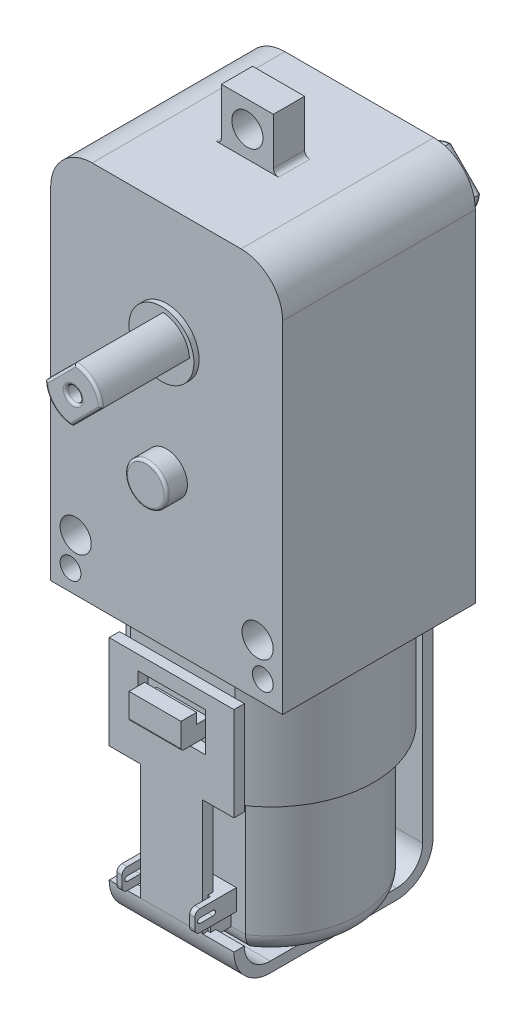
from build123d import *

# Parameters (mm, degrees)
SKETCH1_R                 = 1.5000000000000009
SKETCH1_R_2               = 1.5000000000000018
BOSS_EXTRUDE1_DEPTH       = 9.27
SKETCH2_R                 = 1.0000000000000033
CUT_EXTRUDE1_DEPTH        = 4.5
SKETCH3_R                 = 1.5000000000000009
BOSS_EXTRUDE2_DEPTH       = 1.5
FILLET1_R                 = 0.5
BOSS_EXTRUDE3_DEPTH       = 11.33
BOSS_EXTRUDE4_DEPTH       = 8
BOSS_EXTRUDE7_DEPTH       = 5.5
FILLET2_R                 = 1.75
BOSS_EXTRUDE8_DEPTH       = 2.5
BOSS_EXTRUDE10_DEPTH      = 2
SKETCH11_R                = 0.99
BOSS_EXTRUDE11_DEPTH      = 0.75
FILLET3_R                 = 0.2
FILLET4_R                 = 0.5
EXTRUDE_THIN2_DEPTH       = 6
SKETCH17_R                = 5.444401468277598
CUT_EXTRUDE4_DEPTH        = 1
CUT_EXTRUDE6_START        = -1
CUT_EXTRUDE6_DEPTH        = 1
BOSS_EXTRUDE13_DEPTH      = 1
BOSS_EXTRUDE13_DEPTH_BACK = 2.5
SKETCH14_W                = 6.5
SKETCH14_H                = 1.9999999999999991
BOSS_EXTRUDE14_DEPTH      = 0.5
BOSS_EXTRUDE17_DEPTH      = 2
BOSS_EXTRUDE18_REACH      = 53.271
SKETCH21_W                = 5
SKETCH21_H                = 1.500000000000007
SKETCH22_R                = 2.7
SKETCH22_R_2              = 0.7000000000000001
BOSS_EXTRUDE19_DEPTH      = 9
CUT_EXTRUDE7_DEPTH        = 9
SKETCH24_R                = 3.1250000000000004
SKETCH24_R_2              = 0.7000000000000001
BOSS_EXTRUDE20_DEPTH      = 0.5
CUT_EXTRUDE8_DEPTH        = 8.5
SKETCH26_R                = 2
BOSS_EXTRUDE21_DEPTH      = 2
FILLET5_R                 = 0.25


with BuildPart() as part:
    # Sketch1 → Boss-Extrude1 (new, symmetric)
    with BuildSketch(Plane.XY):
        with BuildLine():
            Line((-11.160000000000002, -18.400000000000002), (11.159999999999998, -18.400000000000002))
            Line((11.159999999999998, -18.400000000000002), (11.159999999999998, 14.399999999999997))
            ThreePointArc((11.159999999999998, 14.399999999999997), (9.98842712474619, 17.228427124746187), (7.159999999999998, 18.4))
            Line((7.159999999999998, 18.4), (-7.160000000000001, 18.4))
            ThreePointArc((-7.160000000000001, 18.4), (-9.988427124746192, 17.228427124746187), (-11.160000000000002, 14.399999999999997))
            Line((-11.160000000000002, 14.399999999999997), (-11.160000000000002, -18.400000000000002))
        make_face()
        with Locations((8.750000000000007, -13.399999999999995)):
            Circle(SKETCH1_R, mode=Mode.SUBTRACT)
        with Locations(Location((-8.749999999999998, -13.399999999999997, 0), (0, 0, 180))):
            Circle(SKETCH1_R_2, mode=Mode.SUBTRACT)
    extrude(amount=BOSS_EXTRUDE1_DEPTH, both=True)

    # Sketch2 → Cut-Extrude1 (cut)
    with BuildSketch(Plane.XY.offset(9.27)):
        with Locations((9.250000000000009, -16.400000000000006)):
            Circle(SKETCH2_R)
        with Locations(Location((-9.249999999999998, -16.40000000000001, 0), (0, 0, 180))):
            Circle(SKETCH2_R)
    cut_extrude1 = extrude(amount=-CUT_EXTRUDE1_DEPTH, mode=Mode.SUBTRACT)

    # Mirror1: Cut-Extrude1 across plane
    add(cut_extrude1.mirror(Plane.XY), mode=Mode.SUBTRACT)

    # Sketch3 → Boss-Extrude2 (add, symmetric)
    with BuildSketch(Plane.XY):
        Polygon((-2.5, 18.4), (2.5, 18.4), (2.5, 23.400000000000002), (-2.5, 23.400000000000006), align=None)
        with Locations((1.76e-15, 20.900000000000002)):
            Circle(SKETCH3_R, mode=Mode.SUBTRACT)
    extrude(amount=BOSS_EXTRUDE2_DEPTH, both=True)

    # Fillet1
    fillet1_edges = [part.edges().sort_by_distance(p)[0] for p in [
        (2.5, 18.4, 0),
        (-2.5, 18.4, 0),
    ]]
    fillet(fillet1_edges, radius=FILLET1_R)

    # Sketch4 → Boss-Extrude3 (add)
    with BuildSketch(Plane.XZ.offset(18.400000000000002)):
        with BuildLine():
            Line((-5.02893626923229, -9.27), (5.02893626923229, -9.27))
            ThreePointArc((5.02893626923229, -9.27), (9.866661310245673, -0.7811363887090915), (5.028936269232289, 7.707727222581812))
            Line((5.028936269232289, 7.707727222581812), (-5.028936269232289, 7.707727222581812))
            ThreePointArc((-5.028936269232289, 7.707727222581812), (-9.866661310245672, -0.7811363887090925), (-5.02893626923229, -9.27))
        make_face()
    extrude(amount=BOSS_EXTRUDE3_DEPTH)

    # Sketch5 → Boss-Extrude4 (add)
    with BuildSketch(Plane.XZ.offset(29.730000000000004)):
        with BuildLine():
            Line((4.629510389115316, 6.3077272225818115), (-4.629510389115315, 6.3077272225818115))
            ThreePointArc((-4.629510389115315, 6.3077272225818115), (-8.466661310245671, -0.7811363887090927), (-4.629510389115316, -7.869999999999998))
            Line((-4.629510389115316, -7.869999999999998), (4.629510389115316, -7.869999999999998))
            ThreePointArc((4.629510389115316, -7.869999999999998), (8.466661310245673, -0.7811363887090937), (4.629510389115316, 6.3077272225818115))
        make_face()
    extrude(amount=BOSS_EXTRUDE4_DEPTH)

    # Sketch9 → Boss-Extrude8 (add, symmetric)
    with BuildSketch(Plane(origin=(0, 0, 0), x_dir=(0, 0, -1), z_dir=(1, 0, 0))):
        with BuildLine():
            Line((10.449999999999996, -22.735000000000007), (11.949999999999996, -22.735000000000007))
            Line((11.949999999999996, -22.735000000000007), (11.949999999999996, -24.985000000000003))
            ThreePointArc((11.949999999999996, -24.985000000000003), (11.876776695296632, -25.16177669529664), (11.699999999999996, -25.235000000000003))
            Line((11.699999999999996, -25.235000000000003), (9.269999999999996, -25.235000000000003))
            Line((9.269999999999996, -25.235000000000003), (9.269999999999996, -23.735))
            Line((9.269999999999996, -23.735), (10.449999999999996, -23.735))
            Line((10.449999999999996, -23.735), (10.449999999999996, -22.735000000000007))
        make_face()
    boss_extrude8 = extrude(amount=BOSS_EXTRUDE8_DEPTH, both=True)

    # Mirror2: Boss-Extrude8 across plane
    add(boss_extrude8.mirror(Plane.XY.offset(-0.78113639)))



with BuildPart() as body_2:
    # Sketch8 → Boss-Extrude7 (new body)
    with BuildSketch(Plane.XZ.offset(37.73)):
        with BuildLine():
            Line((4.629510389115312, 6.307727222581813), (-4.629510389115312, 6.307727222581813))
            ThreePointArc((-4.629510389115312, 6.307727222581813), (-8.466661310245671, -0.781136388709089), (-4.6295103891153175, -7.8699999999999966))
            Line((-4.6295103891153175, -7.8699999999999966), (4.629510389115311, -7.870000000000002))
            ThreePointArc((4.629510389115311, -7.870000000000002), (8.466661310245675, -0.7811363887090937), (4.629510389115312, 6.307727222581813))
        make_face()
    extrude(amount=BOSS_EXTRUDE7_DEPTH)

    # Fillet2
    # the kernel refuses this fillet: 1.75 mm, written as the material it takes off along each edge
    with BuildSketch(Plane(origin=(4.88e-15, -43.23, -0.7811363887090941), x_dir=(-0.06142631905832715, 0, 0.9981116206752353), z_dir=(0.9981116206752353, 0, 0.06142631905832715))) as fillet2_piece_1:
        with BuildLine():
            CenterArc((8.466661310245678 - FILLET2_R, -FILLET2_R), FILLET2_R, 0, 89.99999999999997)
            Line((8.466661310245678 - FILLET2_R, 0), (8.466661310245678, 0))
            Line((8.466661310245678, 0), (8.466661310245676, -FILLET2_R))
        make_face()
    revolve(axis=Axis((4.88e-15, -43.23, -0.7811363887090941), (0, -1, 0)), revolution_arc=172.95662825627966, mode=Mode.SUBTRACT)
    with BuildSketch(Plane(origin=(-9.004510389115318, -43.23, -7.869999999999994), x_dir=(0, 1, 0), z_dir=(1, 0, -5.8e-16))) as fillet2_piece_2:
        with BuildLine():
            CenterArc((FILLET2_R, FILLET2_R), FILLET2_R, 180, 90)
            Line((0, FILLET2_R), (0, 0))
            Line((0, 0), (FILLET2_R, 0))
        make_face()
    extrude(amount=18.009020778230628, mode=Mode.SUBTRACT)
    with BuildSketch(Plane(origin=(6.66e-15, -43.23, -0.7811363887090939), x_dir=(0.06142631905832556, 0, -0.9981116206752353), z_dir=(-0.9981116206752353, 0, -0.06142631905832556))) as fillet2_piece_3:
        with BuildLine():
            CenterArc((8.466661310245671 - FILLET2_R, -FILLET2_R), FILLET2_R, 0, 89.99999999999989)
            Line((8.466661310245671 - FILLET2_R, 0), (8.466661310245671, 0))
            Line((8.466661310245671, 0), (8.46666131024567, -FILLET2_R))
        make_face()
    revolve(axis=Axis((6.66e-15, -43.23, -0.7811363887090939), (0, -1, 0)), revolution_arc=172.95662825627988, mode=Mode.SUBTRACT)
    with BuildSketch(Plane(origin=(9.004510389115312, -43.23, 6.307727222581813), x_dir=(0, 1, 0), z_dir=(-1, 0, 0))) as fillet2_piece_4:
        with BuildLine():
            CenterArc((FILLET2_R, FILLET2_R), FILLET2_R, 180, 90)
            Line((0, FILLET2_R), (0, 0))
            Line((0, 0), (FILLET2_R, 0))
        make_face()
    extrude(amount=18.009020778230624, mode=Mode.SUBTRACT)

    # Sketch10 → Boss-Extrude10 (add)
    with BuildSketch(Plane.XZ.offset(43.23)):
        with BuildLine():
            Line((-3.962436119358896, 2.2188636112909066), (3.962436119358899, 2.2188636112909066))
            ThreePointArc((3.962436119358899, 2.2188636112909066), (8.2e-16, -5.751136388709094), (-3.962436119358896, 2.2188636112909066))
        make_face()
    extrude(amount=BOSS_EXTRUDE10_DEPTH)

    # Sketch11 → Boss-Extrude11 (add)
    with BuildSketch(Plane.XZ.offset(45.23)):
        with Locations(Location((1.52e-15, -0.8404766655493063, 0), (0, 0, 270))):
            Circle(SKETCH11_R)
    extrude(amount=BOSS_EXTRUDE11_DEPTH)

    # Fillet3
    fillet3_edges = [body_2.edges().sort_by_distance(p)[0] for p in [
        (1.82e-15, -45.98, 0.14952333445069366),
    ]]
    fillet(fillet3_edges, radius=FILLET3_R)

    # Fillet4
    fillet4_edges = [body_2.edges().sort_by_distance(p)[0] for p in [
        (2.11e-15, -43.23, -5.751136388709094),
        (-3.9624361193588964, -44.23, 2.2188636112909066),
        (1.33e-15, -43.23, 2.2188636112909066),
        (3.962436119358899, -44.23, 2.2188636112909066),
        (2.11e-15, -45.23, -5.751136388709094),
        (1.33e-15, -45.23, 2.2188636112909066),
    ]]
    fillet(fillet4_edges, radius=FILLET4_R)


with BuildPart() as part_1:
    add(part.part)

    add(body_2.part)  # Extrude-Thin2 merges body 2
    # Sketch16 → Extrude-Thin2 (add, symmetric)
    with BuildSketch(Plane(origin=(0, 0, 0), x_dir=(0, 0, -1), z_dir=(1, 0, 0))):
        with BuildLine():
            Line((-8.797727221290906, -20.800459056820337), (-8.7977272212909, -40.99999999999999))
            ThreePointArc((-8.7977272212909, -40.99999999999997), (-7.772600955443863, -43.474873734152965), (-5.297727221290895, -44.49999999999999))
            Line((-5.297727221290903, -44.5), (6.859999999999996, -44.5))
            ThreePointArc((6.860000000000013, -44.5), (9.334873734152866, -43.47487373415288), (10.360000000000005, -41))
            Line((10.359999999999994, -40.99999999999999), (10.359999999999992, -20.999999999999993))
            Line((10.359999999999992, -20.999999999999993), (9.359999999999992, -20.999999999999993))
            Line((9.359999999999992, -20.999999999999993), (9.359999999999994, -40.99999999999999))
            ThreePointArc((9.359999999999983, -40.999999999999986), (8.627766952966311, -42.76776695296633), (6.859999999999979, -43.5))
            Line((6.859999999999996, -43.5), (-5.297727221290903, -43.5))
            ThreePointArc((-5.297727221290911, -43.50000000000001), (-7.065494174257305, -42.767766952966426), (-7.7977272212909, -41.000000000000014))
            Line((-7.7977272212909, -40.99999999999999), (-7.797727221290906, -20.800459056820337))
            Line((-7.797727221290906, -20.800459056820337), (-8.797727221290906, -20.800459056820337))
        make_face()
    extrude(amount=EXTRUDE_THIN2_DEPTH, both=True)

    # Sketch17 → Cut-Extrude4 (cut)
    with BuildSketch(Plane.XZ.offset(44.5)):
        with Locations(Location((1.73e-15, -0.7811363887090937, 0), (0, 0, 270))):
            Circle(SKETCH17_R)
    extrude(amount=-CUT_EXTRUDE4_DEPTH, mode=Mode.SUBTRACT)


with BuildPart() as cut_extrude4_piece_1:
    # of the separate pieces the step leaves, piece 1, a body of its own (cut_extrude4_pieces)
    add(part_1.part.solids().sort_by_distance((-6, -44.5, 5.297727221))[0])

    # Sketch18 → Cut-Extrude6 (cut)
    with BuildSketch(Plane.XY.offset(8.797727221290911).offset(CUT_EXTRUDE6_START)):
        Polygon((6, -40.99999999999999), (2.999999999999999, -40.99999999999999), (3, -29.823949682632044), (6, -29.823949682632044), align=None)
        Polygon((-3.25, -22.183170727295014), (3.25, -22.183170727295014), (3.250000000000001, -25.933170727295014), (-3.250000000000001, -25.933170727295014), align=None)
        Polygon((-6, -29.823949682632044), (-3, -29.823949682632044), (-2.999999999999999, -40.99999999999999), (-6, -40.99999999999999), align=None)
    extrude(amount=CUT_EXTRUDE6_DEPTH, mode=Mode.SUBTRACT)


with BuildPart() as cut_extrude4_piece_2:
    # of the separate pieces the step leaves, piece 2, a body of its own (cut_extrude4_pieces)
    add(part_1.part.solids().sort_by_distance((3.705522905, -45.23, 1.718863611))[0])


with BuildPart() as cut_extrude6_piece_1:
    # of the separate pieces the step leaves, piece 1, a body of its own (cut_extrude6_pieces)
    add(cut_extrude4_piece_1.part.solids().sort_by_distance((-6, -44.5, 5.297727221))[0])

    # Sketch14 → Boss-Extrude13 (add, two sides: drawn at the far end of the back side and taken through both)
    with BuildSketch(Plane(origin=(0, -39, 0), x_dir=(1, 0, 0), z_dir=(0, 1, 0)).offset(-BOSS_EXTRUDE13_DEPTH_BACK)):
        with Locations((4.4e-16, -7.307727222581812)):
            Rectangle(SKETCH14_W, SKETCH14_H)
    extrude(amount=BOSS_EXTRUDE13_DEPTH + BOSS_EXTRUDE13_DEPTH_BACK)

    # Sketch15 → Boss-Extrude14 (add)
    with BuildSketch(Plane.ZY.offset(3.2499999999999996)):
        with BuildLine():
            Line((6.307727222581813, -38), (9.807727222581809, -38))
            ThreePointArc((9.807727222581809, -38), (10.161280613175085, -38.14644660940672), (10.307727222581812, -38.5))
            Line((10.307727222581812, -38.5), (10.307727222581812, -39.5))
            ThreePointArc((10.307727222581812, -39.5), (10.161280613175085, -39.85355339059328), (9.807727222581809, -40))
            Line((9.807727222581809, -40), (6.307727222581813, -40))
            Line((6.307727222581813, -40), (6.307727222581813, -38))
        make_face()
        with BuildLine():
            Line((9.807727222581812, -39.233411749660384), (8.557727222581814, -39.233411749660384))
            ThreePointArc((8.557727222581814, -39.233411749660384), (8.32431547292143, -39), (8.557727222581814, -38.766588250339616))
            Line((8.557727222581814, -38.766588250339616), (9.807727222581812, -38.766588250339616))
            ThreePointArc((9.807727222581812, -38.766588250339616), (10.041138972242196, -39), (9.807727222581812, -39.233411749660384))
        make_face(mode=Mode.SUBTRACT)
    boss_extrude14 = extrude(amount=BOSS_EXTRUDE14_DEPTH)

    # Mirror3: Boss-Extrude14 across plane
    add(boss_extrude14.mirror(Plane(origin=(0, 0, 0), x_dir=(0, 0, 1), z_dir=(1, 0, 0))))

    # Sketch6 → Boss-Extrude17 (add)
    with BuildSketch(Plane.XZ.offset(37.73)):
        with BuildLine():
            Line((4.629510389115312, 6.307727222581813), (-4.629510389115312, 6.307727222581813))
            ThreePointArc((-4.629510389115312, 6.307727222581813), (-8.466661310245671, -0.781136388709089), (-4.6295103891153175, -7.8699999999999966))
            Line((-4.6295103891153175, -7.8699999999999966), (4.629510389115311, -7.870000000000002))
            ThreePointArc((4.629510389115311, -7.870000000000002), (8.466661310245675, -0.7811363887090937), (4.629510389115312, 6.307727222581813))
        make_face()
    extrude(amount=BOSS_EXTRUDE17_DEPTH)


with BuildPart() as cut_extrude6_piece_2:
    # of the separate pieces the step leaves, piece 2, a body of its own (cut_extrude6_pieces)
    add(cut_extrude4_piece_1.part.solids().sort_by_distance((2.5, -23.735, 8.88772722))[0])

    # Sketch21 → Boss-Extrude18 (add, up to next)
    with BuildSketch(Plane.XY.offset(7.79772722129091), mode=Mode.PRIVATE) as boss_extrude18_sk1:
        with Locations((0, -24.485)):
            Rectangle(SKETCH21_W, SKETCH21_H)
    boss_extrude18_tool1 = extrude(boss_extrude18_sk1.sketch, amount=BOSS_EXTRUDE18_REACH, mode=Mode.PRIVATE) - cut_extrude6_piece_2.part

    add(cut_extrude6_piece_1.part)  # Boss-Extrude18 merges Cut-Extrude6 piece 1
    add(boss_extrude18_tool1.solids().sort_by_distance((0, -24.485, 7.797727))[0])

    # Sketch22 → Boss-Extrude19 (add)
    with BuildSketch(Plane.XY.offset(9.27)):
        with Locations(Location((2.49e-15, 7.149999999999997, 0), (0, 0, 180))):
            Circle(SKETCH22_R)
        with Locations((2.49e-15, 7.149999999999997)):
            Circle(SKETCH22_R_2, mode=Mode.SUBTRACT)
    boss_extrude19 = extrude(amount=BOSS_EXTRUDE19_DEPTH)

    # Mirror4: Boss-Extrude19 across plane
    add(boss_extrude19.mirror(Plane.XY))

    # Sketch23 → Cut-Extrude7 (cut)
    with BuildSketch(Plane.XY.offset(18.27)):
        with BuildLine():
            Line((-2.6958171532115527, 6.999767259059987), (0.15023274093996186, 9.845817153211554))
            ThreePointArc((0.15023274093996186, 9.845817153211554), (-1.909188309203693, 9.059188309203657), (-2.6958171532115527, 6.999767259059987))
        make_face()
        with BuildLine():
            Line((-0.1502327409399597, 4.454182846788439), (2.6958171532115576, 7.300232740940005))
            ThreePointArc((2.6958171532115576, 7.300232740940005), (1.9091883092036972, 5.240811690796334), (-0.1502327409399597, 4.454182846788439))
        make_face()
    extrude(amount=-CUT_EXTRUDE7_DEPTH, mode=Mode.SUBTRACT)

    # Sketch24 → Boss-Extrude20 (add)
    with BuildSketch(Plane.XY.offset(9.27)):
        with Locations(Location((2.49e-15, 7.149999999999997, 0), (0, 0, 180))):
            Circle(SKETCH24_R)
        with Locations((2.49e-15, 7.149999999999997)):
            Circle(SKETCH24_R_2, mode=Mode.SUBTRACT)
    boss_extrude20 = extrude(amount=BOSS_EXTRUDE20_DEPTH)

    # Mirror5: Boss-Extrude20 across plane
    add(boss_extrude20.mirror(Plane.XY))

    # Sketch25 → Cut-Extrude8 (cut)
    with BuildSketch(Plane(origin=(0, 0, -18.27), x_dir=(-1, 0, 0), z_dir=(0, 0, -1))):
        with BuildLine():
            Line((-2.6958171532115585, 6.999767259060012), (0.15023274093998226, 9.845817153211552))
            ThreePointArc((0.15023274093998226, 9.845817153211552), (-1.90918830920368, 9.059188309203675), (-2.6958171532115585, 6.999767259060012))
        make_face()
        with BuildLine():
            Line((-0.15023274093998962, 4.454182846788441), (2.6958171532115536, 7.300232740939985))
            ThreePointArc((2.6958171532115536, 7.300232740939985), (1.909188309203676, 5.240811690796319), (-0.15023274093998962, 4.454182846788441))
        make_face()
    extrude(amount=-CUT_EXTRUDE8_DEPTH, mode=Mode.SUBTRACT)

    # Sketch26 → Boss-Extrude21 (add)
    with BuildSketch(Plane.XY.offset(9.27)):
        with Locations(Location((3.47e-15, -3.8500000000000028, 0), (0, 0, 180))):
            Circle(SKETCH26_R)
    extrude(amount=BOSS_EXTRUDE21_DEPTH)

    # Fillet5
    fillet5_edges = [cut_extrude6_piece_2.edges().sort_by_distance(p)[0] for p in [
        (-0.6999999999999976, 7.149999999999997, 18.27),
        (-0.6999999999999976, 7.149999999999997, -18.27),
        (-1.9091883092036592, 5.240811690796302, 18.27),
        (-1.2727922061357955, 8.422792206135771, 18.27),
        (1.9091883092036634, 9.059188309203693, 18.27),
        (1.2727922061357988, 5.877207793864222, 18.27),
        (1.9091883092036814, 5.240811690796319, -18.27),
        (-1.2727922061357821, 5.877207793864213, -18.27),
        (-1.9091883092036739, 9.059188309203678, -18.27),
        (1.2727922061357881, 8.422792206135782, -18.27),
        (2.0000000000000036, -3.850000000000003, 11.27),
    ]]
    fillet(fillet5_edges, radius=FILLET5_R)


solid = Compound([cut_extrude4_piece_2.part, cut_extrude6_piece_2.part])
